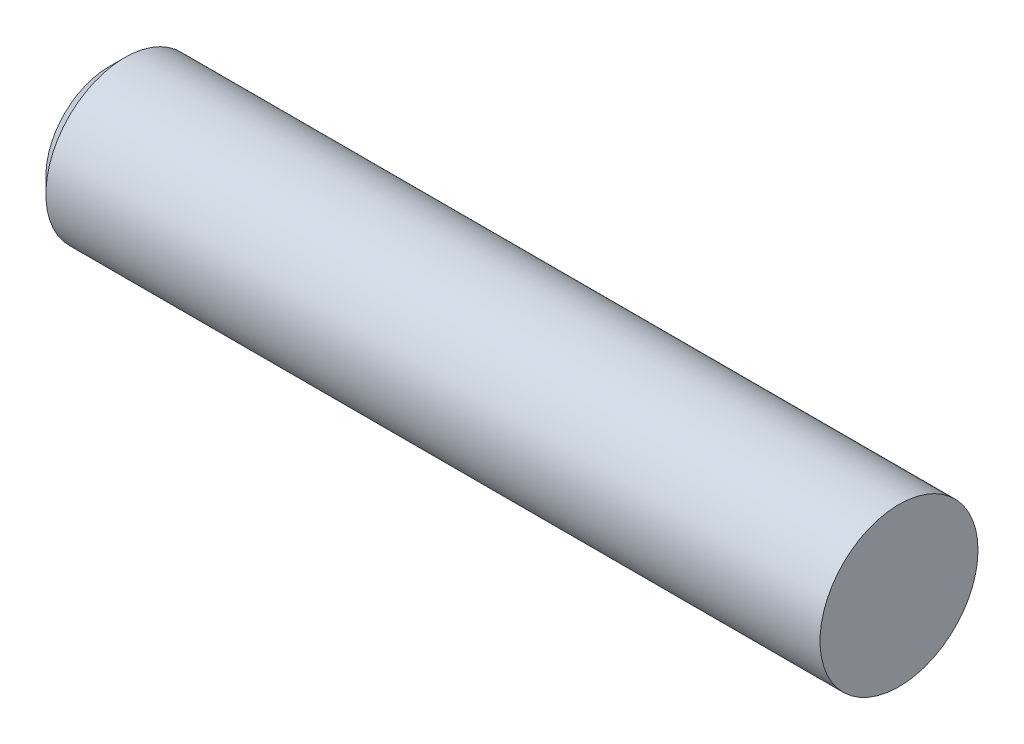
from build123d import *

# Parameters (mm, degrees)
EXTRUDE1_DEPTH        = 7.9375
EXTRUDE1_DEPTH_BACK   = 7.9375
SKETCH2_R             = 1.5875
CHAMFER1_SIZE         = 0.3175
DELETEFACE1_START     = 7.6199999
DELETEFACE1_OUTLINE_R = 1.5875
DELETEFACE1_DEPTH     = 0.3175001


# Read off the part's stored shape, not the designer's step: DeleteFace1
with BuildPart() as part:
    # Sketch2 → Extrude1 (new, two sides: drawn at the far end of the back side and taken through both)
    with BuildSketch(Plane(origin=(0, 0, 0), x_dir=(0, 0, -1), z_dir=(1, 0, 0)).offset(-EXTRUDE1_DEPTH_BACK)):
        Circle(SKETCH2_R)
    extrude(amount=EXTRUDE1_DEPTH + EXTRUDE1_DEPTH_BACK)

    # Chamfer1
    chamfer1_edges = [part.edges().sort_by_distance(p)[0] for p in [
        (-7.9375, 0, 1.5875),
        (7.9375, 0, 1.5875),
    ]]
    chamfer(chamfer1_edges, length=CHAMFER1_SIZE)

    # DeleteFace1 outline → DeleteFace1 (add)
    with BuildSketch(Plane.YZ.offset(DELETEFACE1_START)):
        Circle(DELETEFACE1_OUTLINE_R)
    extrude(amount=DELETEFACE1_DEPTH)


solid = part.part
